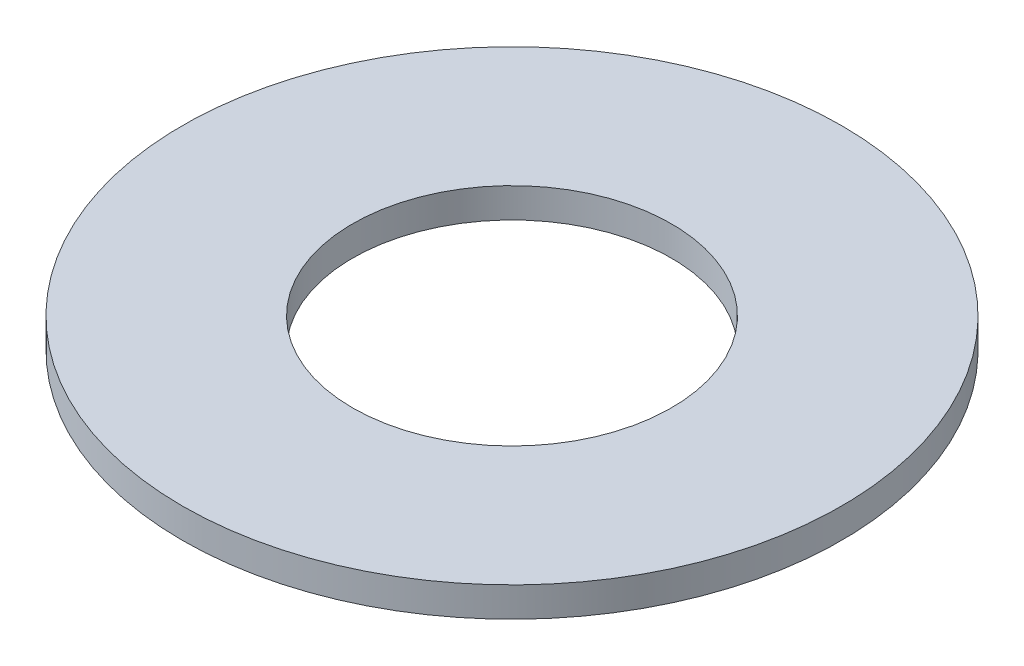
from build123d import *

# Parameters (mm, degrees)
SKETCH1_R           = 77.5
BOSS_EXTRUDE1_DEPTH = 7
SKETCH2_R           = 37.5
CUT_EXTRUDE1_DEPTH  = 110.824860574


with BuildPart() as part:
    # Sketch1 → Boss-Extrude1 (new body)
    with BuildSketch(Plane(origin=(0, 0, 0), x_dir=(1, 0, 0), z_dir=(0, 1, 0))):
        Circle(SKETCH1_R)
    extrude(amount=BOSS_EXTRUDE1_DEPTH)

    # Sketch2 → Cut-Extrude1 (cut, through all)
    with BuildSketch(Plane(origin=(0, 0, 0), x_dir=(1, 0, 0), z_dir=(0, 1, 0))):
        Circle(SKETCH2_R)
    extrude(amount=CUT_EXTRUDE1_DEPTH, mode=Mode.SUBTRACT)


solid = part.part
